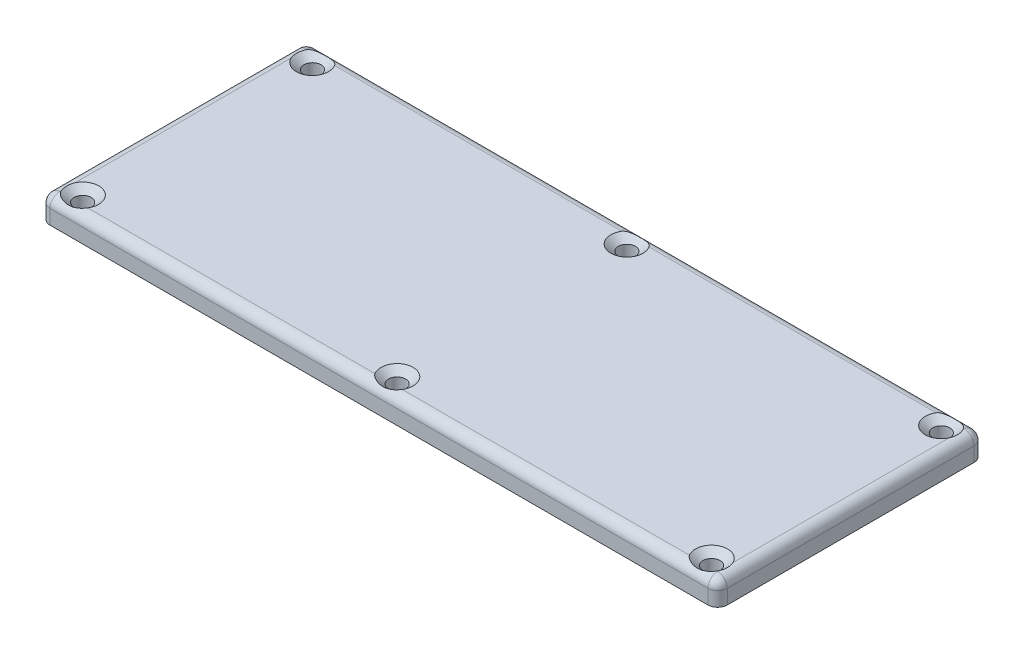
from build123d import *

# Parameters (mm, degrees)
SKETCH1_W                                         = 177.8
SKETCH1_H                                         = 69.85
BOSS_EXTRUDE1_DEPTH                               = 6.35
CSK_FOR_8_FLAT_HEAD_MACHINE_SCREW_100_D           = 4.4958
CSK_FOR_8_FLAT_HEAD_MACHINE_SCREW_100_DEPTH       = 12.7
CSK_FOR_8_FLAT_HEAD_MACHINE_SCREW_100_CSINK_D     = 8.4328
CSK_FOR_8_FLAT_HEAD_MACHINE_SCREW_100_CSINK_ANGLE = 100
CSK_FOR_8_FLAT_HEAD_MACHINE_SCREW_100_TIP         = 1.350674586
FILLET1_R                                         = 2.54


with BuildPart() as part:
    # Sketch1 → Boss-Extrude1 (new body)
    with BuildSketch(Plane(origin=(0, 0, 0), x_dir=(1, 0, 0), z_dir=(0, 1, 0))):
        with Locations((88.9, 34.925)):
            Rectangle(SKETCH1_W, SKETCH1_H)
    extrude(amount=BOSS_EXTRUDE1_DEPTH)

    # CSK for #8 Flat Head Machine Screw (100)1
    with Locations(Plane(origin=(0, 6.35, 0), x_dir=(1, 0, 0), z_dir=(0, 1, 0))):
        with Locations((88.9, 65.0875), (6.35, 65.0875), (171.45, 65.0875), (171.45, 4.7625), (88.9, 4.7625), (6.35, 4.7625)):
            CounterSinkHole(CSK_FOR_8_FLAT_HEAD_MACHINE_SCREW_100_D / 2, CSK_FOR_8_FLAT_HEAD_MACHINE_SCREW_100_CSINK_D / 2, depth=CSK_FOR_8_FLAT_HEAD_MACHINE_SCREW_100_DEPTH, counter_sink_angle=CSK_FOR_8_FLAT_HEAD_MACHINE_SCREW_100_CSINK_ANGLE)
            with Locations((0, 0, -(CSK_FOR_8_FLAT_HEAD_MACHINE_SCREW_100_DEPTH + CSK_FOR_8_FLAT_HEAD_MACHINE_SCREW_100_TIP / 2))):  # 118° drill point
                Cone(0, CSK_FOR_8_FLAT_HEAD_MACHINE_SCREW_100_D / 2, CSK_FOR_8_FLAT_HEAD_MACHINE_SCREW_100_TIP, mode=Mode.SUBTRACT)

    # Fillet1
    # the kernel refuses this fillet: 2.54 mm, written as the material it takes off along each edge
    with BuildSketch(Plane(origin=(175.26, 3.81, -2.54), x_dir=(0, 1, 0), z_dir=(1, 0, 0))) as fillet1_piece_1_section:
        Polygon((0, 0), (FILLET1_R, 0), (FILLET1_R, FILLET1_R), (0, FILLET1_R), align=None)
    fillet1_piece_1 = extrude(amount=FILLET1_R, mode=Mode.PRIVATE)
    fillet1_piece_1 = fillet1_piece_1 - Plane(origin=(175.26, 3.81, -2.54), x_dir=(0, -0.7071067811865475, -0.7071067811865475), z_dir=(1, 0, 0)) * Sphere(FILLET1_R, mode=Mode.PRIVATE)
    add(fillet1_piece_1, mode=Mode.SUBTRACT)
    with BuildSketch(Plane(origin=(175.26, 3.81, -67.31), x_dir=(0, 1, 0), z_dir=(1, 0, 0))) as fillet1_piece_2_section:
        Polygon((0, 0), (FILLET1_R, 0), (FILLET1_R, -FILLET1_R), (0, -FILLET1_R), align=None)
    fillet1_piece_2 = extrude(amount=FILLET1_R, mode=Mode.PRIVATE)
    fillet1_piece_2 = fillet1_piece_2 - Plane(origin=(175.26, 3.81, -67.31), x_dir=(0, -0.7071067811865475, 0.7071067811865475), z_dir=(1, 0, 0)) * Sphere(FILLET1_R, mode=Mode.PRIVATE)
    add(fillet1_piece_2, mode=Mode.SUBTRACT)
    with BuildSketch(Plane(origin=(2.54, 3.81, -67.31), x_dir=(0, 0, -1), z_dir=(0, 1, 0))) as fillet1_piece_3_section:
        Polygon((0, 0), (FILLET1_R, 0), (FILLET1_R, FILLET1_R), (0, FILLET1_R), align=None)
    fillet1_piece_3 = extrude(amount=FILLET1_R, mode=Mode.PRIVATE)
    fillet1_piece_3 = fillet1_piece_3 - Plane(origin=(2.54, 3.81, -67.31), x_dir=(0.7071067811865475, 0, 0.7071067811865475), z_dir=(0, 1, 0)) * Sphere(FILLET1_R, mode=Mode.PRIVATE)
    add(fillet1_piece_3, mode=Mode.SUBTRACT)
    with BuildSketch(Plane(origin=(2.54, 3.81, -2.54), x_dir=(0, 1, 0), z_dir=(0, 0, 1))) as fillet1_piece_4_section:
        Polygon((0, 0), (FILLET1_R, 0), (FILLET1_R, FILLET1_R), (0, FILLET1_R), align=None)
    fillet1_piece_4 = extrude(amount=FILLET1_R, mode=Mode.PRIVATE)
    fillet1_piece_4 = fillet1_piece_4 - Plane(origin=(2.54, 3.81, -2.54), x_dir=(0.7071067811865475, -0.7071067811865475, 0), z_dir=(0, 0, 1)) * Sphere(FILLET1_R, mode=Mode.PRIVATE)
    add(fillet1_piece_4, mode=Mode.SUBTRACT)
    with BuildSketch(Plane(origin=(177.8, 6.35, -2.54), x_dir=(-1, 0, 0), z_dir=(0, 0, -1)), Plane(origin=(0, 6.35, -67.31), x_dir=(1, 0, 0), z_dir=(0, 0, 1))) as fillet1_piece_5:
        with BuildLine():
            CenterArc((FILLET1_R, -FILLET1_R), FILLET1_R, 90, 90)
            Line((0, -FILLET1_R), (0, 0))
            Line((0, 0), (FILLET1_R, 0))
        make_face()
    extrude(amount=64.77, mode=Mode.SUBTRACT)
    with BuildSketch(Plane(origin=(175.26, 6.35, -69.85), x_dir=(0, 0, 1), z_dir=(-1, 0, 0))) as fillet1_piece_6:
        with BuildLine():
            CenterArc((FILLET1_R, -FILLET1_R), FILLET1_R, 90, 90)
            Line((0, -FILLET1_R), (0, 0))
            Line((0, 0), (FILLET1_R, 0))
        make_face()
    extrude(amount=172.72, mode=Mode.SUBTRACT)
    with BuildSketch(Plane(origin=(2.54, 6.35, 0), x_dir=(0, -1, 0), z_dir=(1, 0, 0))) as fillet1_piece_7:
        with BuildLine():
            CenterArc((FILLET1_R, FILLET1_R), FILLET1_R, 180, 90)
            Line((0, FILLET1_R), (0, 0))
            Line((0, 0), (FILLET1_R, 0))
        make_face()
    extrude(amount=172.72, mode=Mode.SUBTRACT)
    with BuildSketch(Plane(origin=(0, -6.35, -69.85), x_dir=(1, 0, 0), z_dir=(0, 1, 0)), Plane(origin=(177.8, -6.35, 0), x_dir=(-1, 0, 0), z_dir=(0, 1, 0))) as fillet1_piece_8:
        with BuildLine():
            CenterArc((FILLET1_R, -FILLET1_R), FILLET1_R, 90, 90)
            Line((0, -FILLET1_R), (0, 0))
            Line((0, 0), (FILLET1_R, 0))
        make_face()
    extrude(amount=10.16, mode=Mode.SUBTRACT)
    with BuildSketch(Plane(origin=(177.8, -6.35, -69.85), x_dir=(-1, 0, 0), z_dir=(0, 1, 0)), Plane(origin=(0, -6.35, 0), x_dir=(1, 0, 0), z_dir=(0, 1, 0))) as fillet1_piece_9:
        with BuildLine():
            CenterArc((FILLET1_R, FILLET1_R), FILLET1_R, 180, 90)
            Line((0, FILLET1_R), (0, 0))
            Line((0, 0), (FILLET1_R, 0))
        make_face()
    extrude(amount=10.16, mode=Mode.SUBTRACT)


solid = part.part
